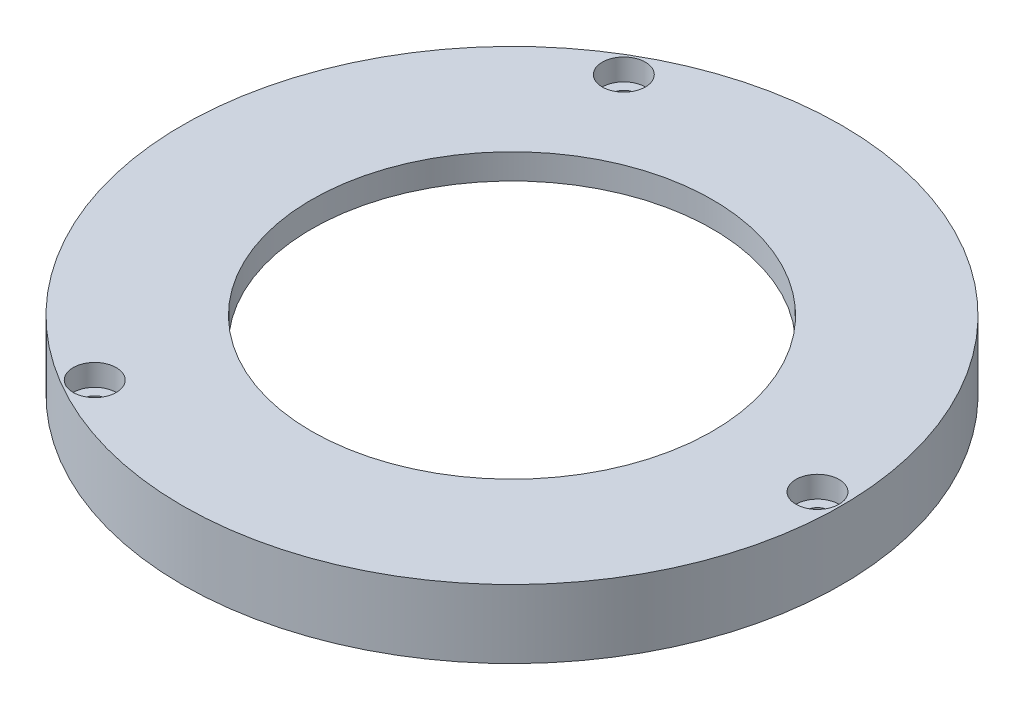
from build123d import *

# Parameters (mm, degrees)
SKETCH1_R           = 45.85
SKETCH1_R_2         = 1.5635
SKETCH1_R_3         = 39.3
BOSS_EXTRUDE1_DEPTH = 6
BOSS_EXTRUDE2_START = 3.525
SKETCH1_4_R         = 45.85
SKETCH1_4_R_2       = 1.5635
SKETCH1_4_R_3       = 27.9
BOSS_EXTRUDE2_DEPTH = 3.525
SKETCH2_R           = 3
CUT_EXTRUDE1_DEPTH  = 3


with BuildPart() as part:
    # Sketch1 → Boss-Extrude1 (new body)
    with BuildSketch(Plane(origin=(0, 0, 0), x_dir=(1, 0, 0), z_dir=(0, 1, 0))):
        Circle(SKETCH1_R)
        with Locations((-21.25, -36.806079661)):
            Circle(SKETCH1_R_2, mode=Mode.SUBTRACT)
        with Locations((-21.25, 36.806079661)):
            Circle(SKETCH1_R_2, mode=Mode.SUBTRACT)
        Circle(SKETCH1_R_3, mode=Mode.SUBTRACT)
        with Locations((42.5, 0)):
            Circle(SKETCH1_R_2, mode=Mode.SUBTRACT)
    extrude(amount=-BOSS_EXTRUDE1_DEPTH)

    # Sketch1<4> → Boss-Extrude2 (add)
    with BuildSketch(Plane(origin=(0, 0, 0), x_dir=(1, 0, 0), z_dir=(0, 1, 0)).offset(BOSS_EXTRUDE2_START)):
        Circle(SKETCH1_4_R)
        with Locations((-21.25, -36.806079661)):
            Circle(SKETCH1_4_R_2, mode=Mode.SUBTRACT)
        with Locations((-21.25, 36.806079661)):
            Circle(SKETCH1_4_R_2, mode=Mode.SUBTRACT)
        with Locations((42.5, 0)):
            Circle(SKETCH1_4_R_2, mode=Mode.SUBTRACT)
        Circle(SKETCH1_4_R_3, mode=Mode.SUBTRACT)
    extrude(amount=-BOSS_EXTRUDE2_DEPTH)

    # Sketch2 → Cut-Extrude1 (cut)
    with BuildSketch(Plane(origin=(0, 3.525, 0), x_dir=(1, 0, 0), z_dir=(0, 1, 0))):
        with Locations((42.5, 0)):
            Circle(SKETCH2_R)
        with Locations((-21.25, -36.806079661)):
            Circle(SKETCH2_R)
        with Locations((-21.25, 36.806079661)):
            Circle(SKETCH2_R)
    extrude(amount=-CUT_EXTRUDE1_DEPTH, mode=Mode.SUBTRACT)


solid = part.part
